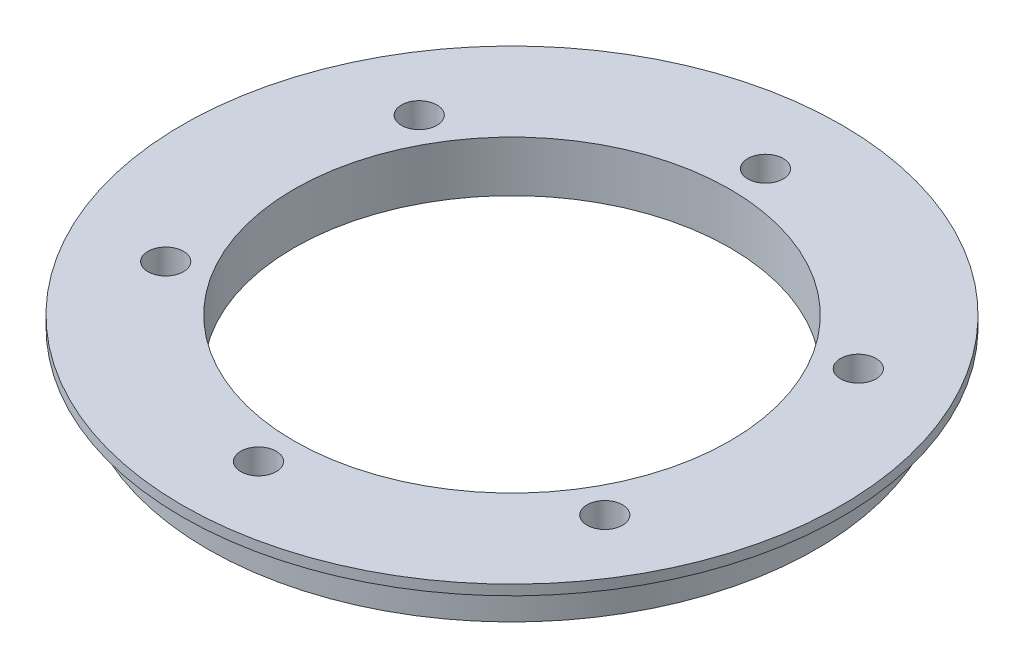
from build123d import *

# Parameters (mm, degrees)
SKETCH1_R           = 30
BOSS_EXTRUDE1_DEPTH = 5
SKETCH2_R           = 32.5
BOSS_EXTRUDE2_DEPTH = 1
SKETCH3_R           = 21.5
CUT_EXTRUDE1_DEPTH  = 25
SKETCH4_R           = 1.75
CUT_EXTRUDE2_DEPTH  = 25


with BuildPart() as part:
    # Sketch1 → Boss-Extrude1 (new body)
    with BuildSketch(Plane(origin=(0, 0, 0), x_dir=(1, 0, 0), z_dir=(0, 1, 0))):
        Circle(SKETCH1_R)
    extrude(amount=BOSS_EXTRUDE1_DEPTH)

    # Sketch2 → Boss-Extrude2 (add)
    with BuildSketch(Plane(origin=(0, 5, 0), x_dir=(1, 0, 0), z_dir=(0, 1, 0))):
        Circle(SKETCH2_R)
    extrude(amount=-BOSS_EXTRUDE2_DEPTH)

    # Sketch3 → Cut-Extrude1 (cut)
    with BuildSketch(Plane.XZ):
        Circle(SKETCH3_R)
    extrude(amount=-CUT_EXTRUDE1_DEPTH, mode=Mode.SUBTRACT)

    # Sketch4 → Cut-Extrude2 (cut)
    with BuildSketch(Plane(origin=(0, 5, 0), x_dir=(1, 0, 0), z_dir=(0, 1, 0))):
        with Locations((0, 25)):
            Circle(SKETCH4_R)
        with Locations((21.650635095, 12.5)):
            Circle(SKETCH4_R)
        with Locations((21.650635095, -12.5)):
            Circle(SKETCH4_R)
        with Locations((0, -25)):
            Circle(SKETCH4_R)
        with Locations((-21.650635095, -12.5)):
            Circle(SKETCH4_R)
        with Locations((-21.650635095, 12.5)):
            Circle(SKETCH4_R)
    extrude(amount=-CUT_EXTRUDE2_DEPTH, mode=Mode.SUBTRACT)


solid = part.part
